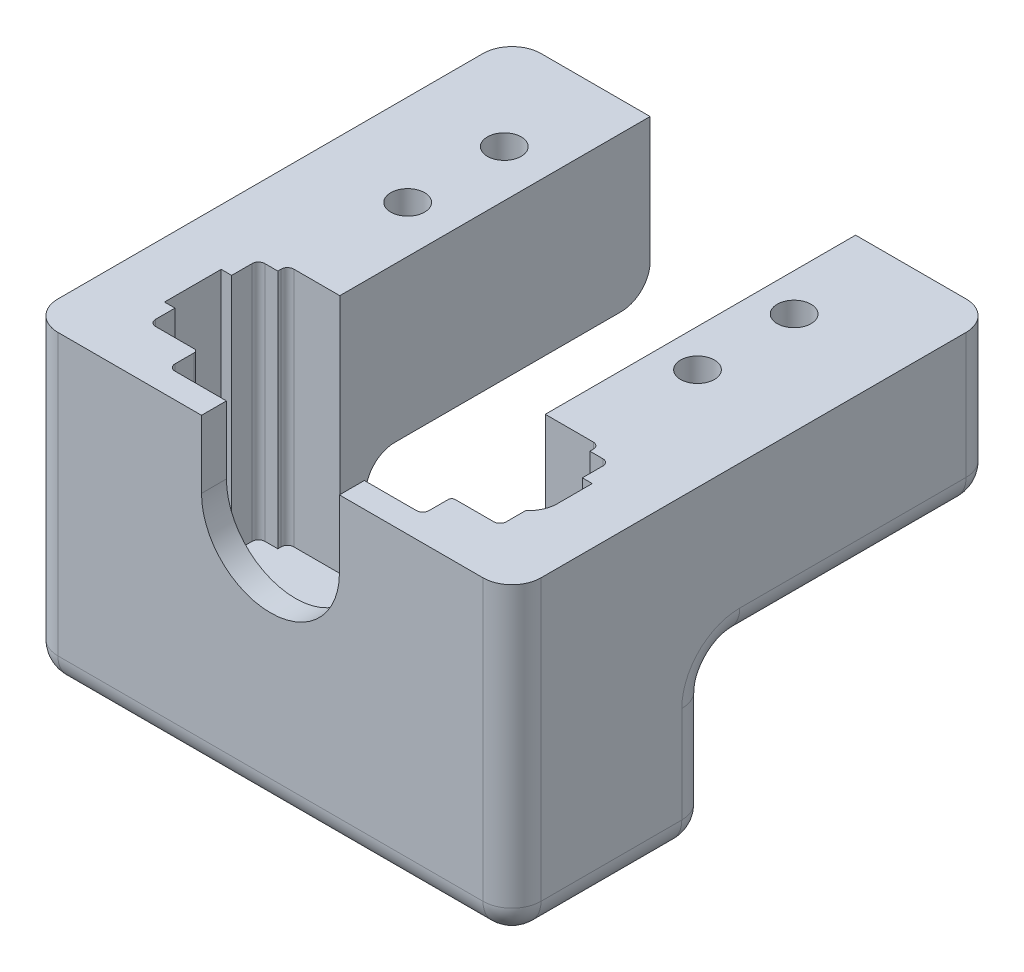
from build123d import *

# Parameters (mm, degrees)
EXTRUDE_1_DEPTH     = 25
CUT_EXTRUDE_1_DEPTH = 10
SKETCH_5_W          = 41.777974616
SKETCH_5_H          = 18.894782553
EXTRUDE_4_DEPTH     = 7.1
SKETCH_6_R          = 1.75
CUT_EXTRUDE_2_DEPTH = 44.301270189
CUT_EXTRUDE_3_DEPTH = 16
FILLET_1_R          = 3
FILLET_3_R          = 3
EXTRUDE_5_DEPTH     = 7
CUT_EXTRUDE_START   = -17
SKETCH_11_R         = 1.75
CUT_EXTRUDE_4_DEPTH = 17
SKETCH_10_R         = 1.75
CUT_EXTRUDE_5_DEPTH = 17


with BuildPart() as part:
    # 草图1 → 凸台-拉伸1 (new body)
    with BuildSketch(Plane(origin=(0, 0, 0), x_dir=(1, 0, 0), z_dir=(0, 1, 0))):
        with BuildLine():
            Line((-25, -25), (25, -25))
            Line((25, -25), (25, 25))
            Line((25, 25), (12.530461135, 25))
            Line((12.530461135, 25), (10.564896285, 25))
            Line((10.564896285, 25), (10.564896285, -7.120248206))
            Line((10.564896285, -7.120248206), (12.530461135, -7.120248206))
            Line((12.530461135, -7.120248206), (15.530461135, -7.120248206))
            ThreePointArc((15.530461135, -7.120248206), (15.990080543, -7.310628798), (16.180461135, -7.770248206))
            Line((16.180461135, -7.770248206), (16.180461135, -8.120248206))
            Line((16.180461135, -8.120248206), (17.530461135, -8.120248206))
            ThreePointArc((17.530461135, -8.120248206), (17.990080543, -8.310628798), (18.180461135, -8.770248206))
            Line((18.180461135, -8.770248206), (18.180461135, -10.898803743))
            Line((18.180461135, -10.898803743), (19.204850948, -10.898803743))
            Line((19.204850948, -10.898803743), (19.204850948, -16.766546625))
            Line((19.204850948, -16.766546625), (18.180461135, -16.766546625))
            Line((18.180461135, -16.766546625), (18.180461135, -18.770248206))
            ThreePointArc((18.180461135, -18.770248206), (17.990080543, -19.229867614), (17.530461135, -19.420248206))
            Line((17.530461135, -19.420248206), (13.530461135, -19.420248206))
            ThreePointArc((13.530461135, -19.420248206), (13.282973762, -19.522760833), (13.180461135, -19.770248206))
            Line((13.180461135, -19.770248206), (13.180461135, -21.770248206))
            ThreePointArc((13.180461135, -21.770248206), (12.990080543, -22.229867614), (12.530461135, -22.420248206))
            Line((12.530461135, -22.420248206), (-12.469538865, -22.420248206))
            ThreePointArc((-12.469538865, -22.420248206), (-12.929158272, -22.229867614), (-13.119538865, -21.770248206))
            Line((-13.119538865, -21.770248206), (-13.119538865, -19.770248206))
            ThreePointArc((-13.119538865, -19.770248206), (-13.222051491, -19.522760833), (-13.469538865, -19.420248206))
            Line((-13.469538865, -19.420248206), (-17.469538865, -19.420248206))
            ThreePointArc((-17.469538865, -19.420248206), (-17.929158272, -19.229867614), (-18.119538865, -18.770248206))
            Line((-18.119538865, -18.770248206), (-18.119538865, -16.766546625))
            Line((-18.119538865, -16.766546625), (-18.180461135, -16.766546625))
            Line((-18.180461135, -16.766546625), (-19.204850948, -16.766546625))
            Line((-19.204850948, -16.766546625), (-19.204850948, -10.898803743))
            Line((-19.204850948, -10.898803743), (-18.180461135, -10.898803743))
            Line((-18.180461135, -10.898803743), (-18.119538865, -10.898803743))
            Line((-18.119538865, -10.898803743), (-18.119538865, -8.770248206))
            ThreePointArc((-18.119538865, -8.770248206), (-17.929158272, -8.310628798), (-17.469538865, -8.120248206))
            Line((-17.469538865, -8.120248206), (-16.119538865, -8.120248206))
            Line((-16.119538865, -8.120248206), (-16.119538865, -7.770248206))
            ThreePointArc((-16.119538865, -7.770248206), (-15.929158272, -7.310628798), (-15.469538865, -7.120248206))
            Line((-15.469538865, -7.120248206), (-14.200297417, -7.120248206))
            Line((-14.200297417, -7.120248206), (-10.70316973, -7.120248206))
            Line((-10.70316973, -7.120248206), (-10.70316973, 25))
            Line((-10.70316973, 25), (-11.261897063, 25))
            Line((-11.261897063, 25), (-25, 25))
            Line((-25, 25), (-25, -25))
        make_face()
    extrude(amount=EXTRUDE_1_DEPTH)

    # 草图2 → 切除-拉伸1 (cut)
    with BuildSketch(Plane.XY.offset(25)):
        with BuildLine():
            Line((7.139013901, 25), (-7.139013901, 25))
            ThreePointArc((-7.139013901, 25), (0, 17.860986099), (7.139013901, 25))
        make_face()
    extrude(amount=-CUT_EXTRUDE_1_DEPTH, mode=Mode.SUBTRACT)

    # 草图5 → 凸台-拉伸4 (add)
    with BuildSketch(Plane.XZ):
        with Locations((0, 13.870801672)):
            Rectangle(SKETCH_5_W, SKETCH_5_H)
    extrude(amount=-EXTRUDE_4_DEPTH)

    # 草图6 → 切除-拉伸2 (cut, through all)
    with BuildSketch(Plane.XZ):
        with Locations(Location((-15.550997874, -4.753034163, 0), (0, 0, 270))):
            Circle(SKETCH_6_R)
        with Locations(Location((-15.550997874, -14.753034163, 0), (0, 0, 270))):
            Circle(SKETCH_6_R)
        with Locations(Location((14.449002126, -4.753034163, 0), (0, 0, 270))):
            Circle(SKETCH_6_R)
        with Locations(Location((14.449002126, -14.753034163, 0), (0, 0, 270))):
            Circle(SKETCH_6_R)
    extrude(amount=-CUT_EXTRUDE_2_DEPTH, mode=Mode.SUBTRACT)

    # 草图7 → 切除-拉伸3 (cut)
    with BuildSketch(Plane.XZ):
        Polygon((-10.70316973, 4.423410395), (-25, 4.423410395), (-25, -26.3625), (26.927678364, -26.3625), (26.927678364, 4.423410395), align=None)
    extrude(amount=-CUT_EXTRUDE_3_DEPTH, mode=Mode.SUBTRACT)

    # 圆角1
    # the kernel refuses this fillet: 3 mm, written as the material it adds along each edge
    with BuildSketch(Plane(origin=(19.204850948, 1.455885595, 16.766546625), x_dir=(0, 0, -1), z_dir=(0, 1, 0))) as fillet_1_piece_1:
        with BuildLine():
            CenterArc((2.257645762, 3), FILLET_1_R, 221.188370699, 48.811629301)
            Line((0, 1.024389812), (0, 0))
            Line((0, 0), (2.257645762, 0))
        make_face()
    extrude(amount=23.544114405)
    with BuildSketch(Plane(origin=(25, 16, 4.423410395), x_dir=(0, 0, -1), z_dir=(-1, 0, 0))) as fillet_1_piece_2:
        with BuildLine():
            CenterArc((FILLET_1_R, FILLET_1_R), FILLET_1_R, 180, 90)
            Line((0, FILLET_1_R), (0, 0))
            Line((0, 0), (FILLET_1_R, 0))
        make_face()
    extrude(amount=14.435103715)
    with BuildSketch(Plane(origin=(-10.70316973, 16, 4.423410395), x_dir=(0, -1, 0), z_dir=(-1, 0, 0))) as fillet_1_piece_3:
        with BuildLine():
            CenterArc((FILLET_1_R, -FILLET_1_R), FILLET_1_R, 90, 90)
            Line((0, -FILLET_1_R), (0, 0))
            Line((0, 0), (FILLET_1_R, 0))
        make_face()
    extrude(amount=14.29683027)
    # the kernel refuses this fillet: 3 mm, written as the material it takes off along each edge
    with BuildSketch(Plane(origin=(-22, 3, 22), x_dir=(0, -1, 0), z_dir=(0, 0, 1))) as fillet_1_2_piece_1_section:
        Polygon((0, 0), (FILLET_1_R * 1.02, 0), (FILLET_1_R * 1.02, -FILLET_1_R * 1.02), (0, -FILLET_1_R * 1.02), align=None)
    fillet_1_2_piece_1 = extrude(amount=FILLET_1_R * 1.02, mode=Mode.PRIVATE)
    fillet_1_2_piece_1 = fillet_1_2_piece_1 - Plane(origin=(-22, 3, 22), x_dir=(0.7071067811865475, 0.7071067811865475, 0), z_dir=(0, 0, 1)) * Sphere(FILLET_1_R, mode=Mode.PRIVATE)
    add(fillet_1_2_piece_1, mode=Mode.SUBTRACT)
    with BuildSketch(Plane(origin=(22, 3, 22), x_dir=(0, -1, 0), z_dir=(0, 0, 1))) as fillet_1_2_piece_2_section:
        Polygon((0, 0), (FILLET_1_R * 1.02, 0), (FILLET_1_R * 1.02, FILLET_1_R * 1.02), (0, FILLET_1_R * 1.02), align=None)
    fillet_1_2_piece_2 = extrude(amount=FILLET_1_R * 1.02, mode=Mode.PRIVATE)
    fillet_1_2_piece_2 = fillet_1_2_piece_2 - Plane(origin=(22, 3, 22), x_dir=(-0.7071067811865475, 0.7071067811865475, 0), z_dir=(0, 0, 1)) * Sphere(FILLET_1_R, mode=Mode.PRIVATE)
    add(fillet_1_2_piece_2, mode=Mode.SUBTRACT)
    with BuildSketch(Plane(origin=(-22, 0, 25), x_dir=(0, 1, 0), z_dir=(1, 0, 0))) as fillet_1_2_piece_3:
        with BuildLine():
            CenterArc((FILLET_1_R, -FILLET_1_R), FILLET_1_R, 90, 90)
            Line((0, -FILLET_1_R), (0, 0))
            Line((0, 0), (FILLET_1_R, 0))
        make_face()
    extrude(amount=44, mode=Mode.SUBTRACT)
    with BuildSketch(Plane(origin=(25, 0, 22), x_dir=(-1, 0, 0), z_dir=(0, 0, -1)), Plane(origin=(-25, 0, -3.076589605), x_dir=(1, 0, 0), z_dir=(0, 0, 1))) as fillet_1_2_piece_4:
        with BuildLine():
            CenterArc((FILLET_1_R, FILLET_1_R), FILLET_1_R, 180, 90)
            Line((0, FILLET_1_R), (0, 0))
            Line((0, 0), (FILLET_1_R, 0))
        make_face()
    extrude(amount=25.076589605, mode=Mode.SUBTRACT)
    with BuildSketch(Plane(origin=(-32.5, 0, 4.423410395), x_dir=(0, 0, 1), z_dir=(1, 0, 0))) as fillet_1_2_piece_5:
        with BuildLine():
            CenterArc((FILLET_1_R, -FILLET_1_R), FILLET_1_R, 90, 90)
            Line((0, -FILLET_1_R), (0, 0))
            Line((0, 0), (FILLET_1_R, 0))
        make_face()
    extrude(amount=65, mode=Mode.SUBTRACT)
    with BuildSketch(Plane(origin=(25, 3, 25), x_dir=(-1, 0, 0), z_dir=(0, 1, 0))) as fillet_1_2_piece_6:
        with BuildLine():
            CenterArc((FILLET_1_R, -FILLET_1_R), FILLET_1_R, 90, 90)
            Line((0, -FILLET_1_R), (0, 0))
            Line((0, 0), (FILLET_1_R, 0))
        make_face()
    extrude(amount=29.5, mode=Mode.SUBTRACT)
    with BuildSketch(Plane(origin=(-25, 3, 25), x_dir=(1, 0, 0), z_dir=(0, 1, 0))) as fillet_1_2_piece_7:
        with BuildLine():
            CenterArc((FILLET_1_R, FILLET_1_R), FILLET_1_R, 180, 90)
            Line((0, FILLET_1_R), (0, 0))
            Line((0, 0), (FILLET_1_R, 0))
        make_face()
    extrude(amount=29.5, mode=Mode.SUBTRACT)
    # the kernel refuses this fillet: 3 mm, written as the material it takes off along each edge
    with BuildSketch(Plane(origin=(-22, 3, 7.423410395), x_dir=(0, 0, -1), z_dir=(-1, 0, 0))) as fillet_1_3_piece_1_section:
        Polygon((0, 0), (FILLET_1_R * 1.02, 0), (FILLET_1_R * 1.02, FILLET_1_R * 1.02), (0, FILLET_1_R * 1.02), align=None)
    fillet_1_3_piece_1 = extrude(amount=FILLET_1_R * 1.02, mode=Mode.PRIVATE)
    fillet_1_3_piece_1 = fillet_1_3_piece_1 - Plane(origin=(-22, 3, 7.423410395), x_dir=(0, 0.7071067811865475, 0.7071067811865475), z_dir=(-1, 0, 0)) * Sphere(FILLET_1_R, mode=Mode.PRIVATE)
    add(fillet_1_3_piece_1, mode=Mode.SUBTRACT)
    with BuildSketch(Plane(origin=(22, 3, 7.423410395), x_dir=(0, 0, -1), z_dir=(1, 0, 0))) as fillet_1_3_piece_2_section:
        Polygon((0, 0), (FILLET_1_R * 1.02, 0), (FILLET_1_R * 1.02, -FILLET_1_R * 1.02), (0, -FILLET_1_R * 1.02), align=None)
    fillet_1_3_piece_2 = extrude(amount=FILLET_1_R * 1.02, mode=Mode.PRIVATE)
    fillet_1_3_piece_2 = fillet_1_3_piece_2 - Plane(origin=(22, 3, 7.423410395), x_dir=(0, 0.7071067811865475, 0.7071067811865475), z_dir=(1, 0, 0)) * Sphere(FILLET_1_R, mode=Mode.PRIVATE)
    add(fillet_1_3_piece_2, mode=Mode.SUBTRACT)
    with BuildSketch(Plane(origin=(25, 16, -32.5), x_dir=(0, 1, 0), z_dir=(0, 0, 1)), Plane(origin=(-25, 16, 1.423410395), x_dir=(0, 1, 0), z_dir=(0, 0, -1))) as fillet_1_3_piece_3:
        with BuildLine():
            CenterArc((FILLET_1_R, FILLET_1_R), FILLET_1_R, 180, 90)
            Line((0, FILLET_1_R), (0, 0))
            Line((0, 0), (FILLET_1_R, 0))
        make_face()
    extrude(amount=33.923410395, mode=Mode.SUBTRACT)
    with BuildSketch(Plane(origin=(25, 3, 4.423410395), x_dir=(0, 0, 1), z_dir=(0, 1, 0))) as fillet_1_3_piece_4:
        with BuildLine():
            CenterArc((FILLET_1_R, -FILLET_1_R), FILLET_1_R, 90, 90)
            Line((0, -FILLET_1_R), (0, 0))
            Line((0, 0), (FILLET_1_R, 0))
        make_face()
    extrude(amount=10, mode=Mode.SUBTRACT)
    with BuildSketch(Plane(origin=(-25, 3, 4.423410395), x_dir=(0, 0, 1), z_dir=(0, 1, 0))) as fillet_1_3_piece_5:
        with BuildLine():
            CenterArc((FILLET_1_R, FILLET_1_R), FILLET_1_R, 180, 90)
            Line((0, FILLET_1_R), (0, 0))
            Line((0, 0), (FILLET_1_R, 0))
        make_face()
    extrude(amount=10, mode=Mode.SUBTRACT)
    with BuildSketch(Plane(origin=(-25, 13, 1.423410395), x_dir=(0, 0, 1), z_dir=(0, -1, 0))) as fillet_1_3_piece_6:
        with BuildLine():
            CenterArc((3 + FILLET_1_R, -FILLET_1_R), FILLET_1_R, 90, 90)
            Line((3, -FILLET_1_R), (3, 0))
            Line((3, 0), (3 + FILLET_1_R, 0))
        make_face()
    revolve(axis=Axis((-25, 13, 1.423410395), (-1, 0, 0)), revolution_arc=90, mode=Mode.SUBTRACT)
    with BuildSketch(Plane(origin=(25, 13, 1.423410395), x_dir=(0, 1, 0), z_dir=(0, 0, -1))) as fillet_1_3_piece_7:
        with BuildLine():
            CenterArc((3 + FILLET_1_R, -FILLET_1_R), FILLET_1_R, 90, 90)
            Line((3, -FILLET_1_R), (3, 0))
            Line((3, 0), (3 + FILLET_1_R, 0))
        make_face()
    revolve(axis=Axis((25, 13, 1.423410395), (1, 0, 0)), revolution_arc=90, mode=Mode.SUBTRACT)

    # 圆角3
    fillet_3_edges = [part.edges().sort_by_distance(p)[0] for p in [
        (16.282448142, 16, -25),
        (24.121320344, 16.878679656, -25),
        (-16.351584865, 16, -25),
        (-24.121320344, 16.878679656, -25),
        (25, 22, -25),
        (-25, 22, -25),
    ]]
    fillet(fillet_3_edges, radius=FILLET_3_R)

    # 草图8 → 凸台-拉伸5 (add)
    with BuildSketch(Plane(origin=(0, 25, 0), x_dir=(1, 0, 0), z_dir=(0, 1, 0))):
        with BuildLine():
            Line((25, -22), (25, 22))
            ThreePointArc((25, 22), (24.121320344, 24.121320344), (22, 25))
            Line((22, 25), (10.564896285, 25))
            Line((10.564896285, 25), (10.564896285, -7.120248206))
            Line((10.564896285, -7.120248206), (15.530461135, -7.120248206))
            ThreePointArc((15.530461135, -7.120248206), (15.990080543, -7.310628798), (16.180461135, -7.770248206))
            Line((16.180461135, -7.770248206), (16.180461135, -8.120248206))
            Line((16.180461135, -8.120248206), (17.530461135, -8.120248206))
            ThreePointArc((17.530461135, -8.120248206), (17.990080543, -8.310628798), (18.180461135, -8.770248206))
            Line((18.180461135, -8.770248206), (18.180461135, -10.898803743))
            Line((18.180461135, -10.898803743), (19.204850948, -10.898803743))
            Line((19.204850948, -10.898803743), (19.204850948, -14.508900863))
            ThreePointArc((19.204850948, -14.508900863), (18.936776145, -15.748491407), (18.180461135, -16.766546625))
            Line((18.180461135, -16.766546625), (18.180461135, -18.770248206))
            ThreePointArc((18.180461135, -18.770248206), (17.990080543, -19.229867614), (17.530461135, -19.420248206))
            Line((17.530461135, -19.420248206), (13.530461135, -19.420248206))
            ThreePointArc((13.530461135, -19.420248206), (13.282973762, -19.522760833), (13.180461135, -19.770248206))
            Line((13.180461135, -19.770248206), (13.180461135, -21.770248206))
            ThreePointArc((13.180461135, -21.770248206), (12.990080543, -22.229867614), (12.530461135, -22.420248206))
            Line((12.530461135, -22.420248206), (7.139013901, -22.420248206))
            Line((7.139013901, -22.420248206), (7.139013901, -25))
            Line((7.139013901, -25), (22, -25))
            ThreePointArc((22, -25), (24.121320344, -24.121320344), (25, -22))
        make_face()
        with BuildLine():
            Line((-10.70316973, 25), (-22, 25))
            ThreePointArc((-22, 25), (-24.121320344, 24.121320344), (-25, 22))
            Line((-25, 22), (-25, -22))
            ThreePointArc((-25, -22), (-24.121320344, -24.121320344), (-22, -25))
            Line((-22, -25), (-7.139013901, -25))
            Line((-7.139013901, -25), (-7.139013901, -22.420248206))
            Line((-7.139013901, -22.420248206), (-12.469538865, -22.420248206))
            ThreePointArc((-12.469538865, -22.420248206), (-12.929158272, -22.229867614), (-13.119538865, -21.770248206))
            Line((-13.119538865, -21.770248206), (-13.119538865, -19.770248206))
            ThreePointArc((-13.119538865, -19.770248206), (-13.222051491, -19.522760833), (-13.469538865, -19.420248206))
            Line((-13.469538865, -19.420248206), (-17.469538865, -19.420248206))
            ThreePointArc((-17.469538865, -19.420248206), (-17.929158272, -19.229867614), (-18.119538865, -18.770248206))
            Line((-18.119538865, -18.770248206), (-18.119538865, -16.766546625))
            Line((-18.119538865, -16.766546625), (-19.204850948, -16.766546625))
            Line((-19.204850948, -16.766546625), (-19.204850948, -10.898803743))
            Line((-19.204850948, -10.898803743), (-18.119538865, -10.898803743))
            Line((-18.119538865, -10.898803743), (-18.119538865, -8.770248206))
            ThreePointArc((-18.119538865, -8.770248206), (-17.929158272, -8.310628798), (-17.469538865, -8.120248206))
            Line((-17.469538865, -8.120248206), (-16.119538865, -8.120248206))
            Line((-16.119538865, -8.120248206), (-16.119538865, -7.770248206))
            ThreePointArc((-16.119538865, -7.770248206), (-15.929158272, -7.310628798), (-15.469538865, -7.120248206))
            Line((-15.469538865, -7.120248206), (-10.70316973, -7.120248206))
            Line((-10.70316973, -7.120248206), (-10.70316973, 25))
        make_face()
    extrude(amount=EXTRUDE_5_DEPTH)

    # 草图11 → 切除-拉伸4 (cut)
    with BuildSketch(Plane(origin=(0, 32, 0), x_dir=(1, 0, 0), z_dir=(0, 1, 0)).offset(CUT_EXTRUDE_START)):
        with Locations(Location((14.449002126, 4.753034163, 0), (0, 0, 90))):
            Circle(SKETCH_11_R)
        with Locations(Location((14.449002126, 14.753034163, 0), (0, 0, 90))):
            Circle(SKETCH_11_R)
    extrude(amount=CUT_EXTRUDE_4_DEPTH, mode=Mode.SUBTRACT)

    # 草图10 → 切除-拉伸5 (cut)
    with BuildSketch(Plane(origin=(0, 32, 0), x_dir=(1, 0, 0), z_dir=(0, 1, 0)).offset(CUT_EXTRUDE_START)):
        with Locations(Location((-15.550997874, 4.753034163, 0), (0, 0, 90))):
            Circle(SKETCH_10_R)
        with Locations(Location((-15.550997874, 14.753034163, 0), (0, 0, 90))):
            Circle(SKETCH_10_R)
    extrude(amount=CUT_EXTRUDE_5_DEPTH, mode=Mode.SUBTRACT)


solid = part.part
